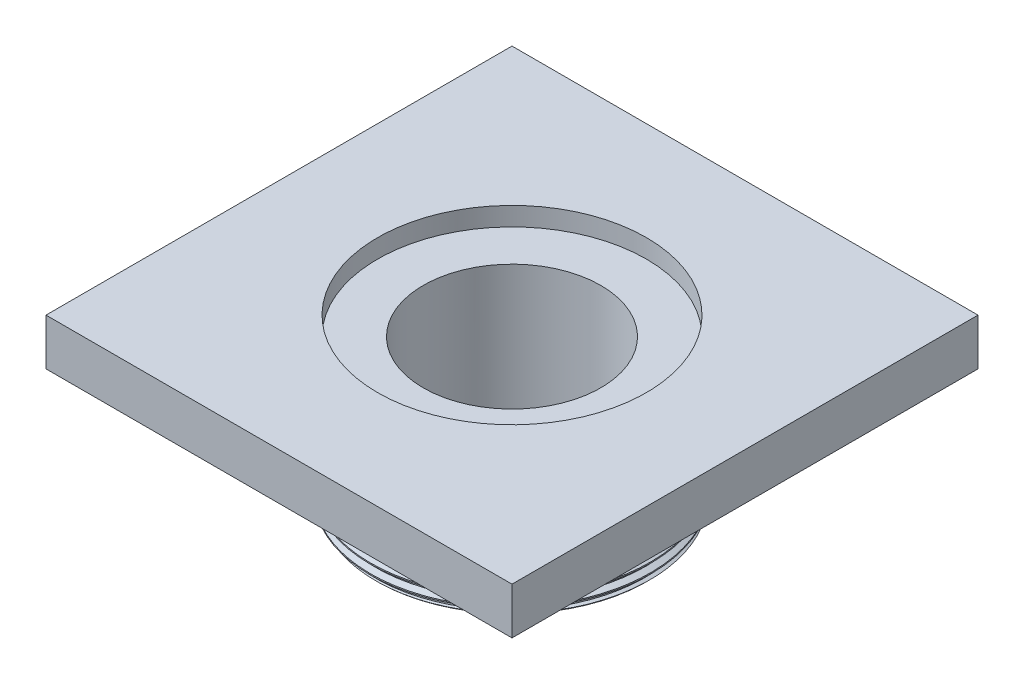
from build123d import *
from build123d.topology import SkipClean

# Parameters (mm, degrees)
SKETCH1_W           = 50
SKETCH1_H           = 50
BOSS_EXTRUDE1_DEPTH = 5
SKETCH2_R           = 15
BOSS_EXTRUDE2_DEPTH = 12.5
FILLET1_R           = 2
SKETCH3_R           = 9.525
CUT_EXTRUDE1_DEPTH  = 40.449334595
CHAMFER1_SIZE       = 0.5
THREAD1_PITCH       = 1
SKETCH6_R           = 14.415891448
CUT_EXTRUDE2_DEPTH  = 2


with BuildPart() as part:
    # Sketch1 → Boss-Extrude1 (new body)
    with BuildSketch(Plane(origin=(0, 0, 0), x_dir=(1, 0, 0), z_dir=(0, 1, 0))):
        Rectangle(SKETCH1_W, SKETCH1_H)
    extrude(amount=BOSS_EXTRUDE1_DEPTH)

    # Sketch2 → Boss-Extrude2 (add)
    with BuildSketch(Plane.XZ):
        with Locations(Location((0, 0, 0), (0, 0, 270))):
            Circle(SKETCH2_R)
    extrude(amount=BOSS_EXTRUDE2_DEPTH)

    # Fillet1
    fillet1_edges = [part.edges().sort_by_distance(p)[0] for p in [
        (0, 0, 15),
    ]]
    fillet(fillet1_edges, radius=FILLET1_R)

    # Sketch3 → Cut-Extrude1 (cut, through all)
    with BuildSketch(Plane.XZ.offset(12.5)):
        with Locations(Location((0, 0, 0), (0, 0, 270))):
            Circle(SKETCH3_R)
    extrude(amount=-CUT_EXTRUDE1_DEPTH, mode=Mode.SUBTRACT)

    # Chamfer1
    chamfer1_edges = [part.edges().sort_by_distance(p)[0] for p in [
        (0, -12.5, 15),
    ]]
    chamfer(chamfer1_edges, length=CHAMFER1_SIZE)

    # Thread1: the profile of Perfil de rosca1 profile screwed along a right-hand helix of 10.922 turns, 8 arcs to a turn; built about Z, then put on its axis
    with SkipClean():  # the faces are left unmerged after this step: merging them gives an invalid solid
        thread1_z = Axis((0, 0, 0), (0, 0, 1))
        thread1_corners = [(15.0003, 0, -0.000173205), (15.0003, 0, 0.875173202), (14.458734125, 0, 0.562499999), (14.458734125, 0, 0.312499999)]
        with BuildLine(mode=Mode.PRIVATE) as thread1_profile:
            Line(thread1_corners[0], thread1_corners[1])
            Line(thread1_corners[1], thread1_corners[2])
            Line(thread1_corners[2], thread1_corners[3])
            Line(thread1_corners[3], thread1_corners[0])
        thread1_cap = Face(thread1_profile.wire())
        thread1_turn_angles = [0, 22.5, 45, 67.5, 90, 112.5, 135, 157.5, 180, 202.5, 225, 247.5, 270, 292.5, 315, 337.5, 360]
        thread1_turn_weights = [1, 0.9238795325112867, 1, 0.9238795325112867, 1, 0.9238795325112867, 1, 0.9238795325112867, 1, 0.9238795325112867, 1, 0.9238795325112867, 1, 0.9238795325112867, 1, 0.9238795325112867, 1]
        thread1_turn_rails = [Edge.make_bspline([Vector(p[0], p[1], 0).rotate(thread1_z, thread1_turn_angles[k]) / thread1_turn_weights[k] + Vector(0, 0, p[2] + THREAD1_PITCH * thread1_turn_angles[k] / 360) for k in range(17)], [0, 0, 0, 1, 1, 2, 2, 3, 3, 4, 4, 5, 5, 6, 6, 7, 7, 8, 8, 8], 2, thread1_turn_weights) for p in thread1_corners]
        thread1_turn_sides = [Face.make_surface_from_curves(thread1_turn_rails[p[0]], thread1_turn_rails[p[1]]) for p in [(0, 1), (1, 2), (2, 3), (3, 0)]]
        thread1_last_angles = [3600, 3622.5, 3645, 3667.5, 3690, 3712.5, 3735, 3757.5, 3780, 3802.5, 3825, 3847.5, 3870, 3892.5, 3915, 3923.46, 3931.92]
        thread1_last_weights = [1, 0.9238795325112867, 1, 0.9238795325112867, 1, 0.9238795325112867, 1, 0.9238795325112867, 1, 0.9238795325112867, 1, 0.9238795325112867, 1, 0.9238795325112867, 1, 0.9891188127719617, 1]
        thread1_last_rails = [Edge.make_bspline([Vector(p[0], p[1], 0).rotate(thread1_z, thread1_last_angles[k]) / thread1_last_weights[k] + Vector(0, 0, p[2] + THREAD1_PITCH * thread1_last_angles[k] / 360) for k in range(17)], [0, 0, 0, 1, 1, 2, 2, 3, 3, 4, 4, 5, 5, 6, 6, 7, 7, 8, 8, 8], 2, thread1_last_weights) for p in thread1_corners]
        thread1_last_sides = [Face.make_surface_from_curves(thread1_last_rails[p[0]], thread1_last_rails[p[1]]) for p in [(0, 1), (1, 2), (2, 3), (3, 0)]]
        thread1 = Plane(origin=(0, -2, 0), x_dir=(-1, 0, 0), z_dir=(0, -1, 0)) * Solid(Shell([*[p.moved(Location((0, 0, THREAD1_PITCH * i))) for i in range(10) for p in thread1_turn_sides], *thread1_last_sides, thread1_cap, thread1_cap.rotate(thread1_z, 3931.92).moved(Location((0, 0, THREAD1_PITCH * 3931.92 / 360)))]))
        add(thread1, mode=Mode.SUBTRACT)

    # Sketch6 → Cut-Extrude2 (cut)
    with SkipClean():  # the faces are left unmerged after this step: merging them gives an invalid solid
        with BuildSketch(Plane(origin=(0, 5, 0), x_dir=(1, 0, 0), z_dir=(0, 1, 0))):
            with Locations(Location((0, 0, 0), (0, 0, 270))):
                Circle(SKETCH6_R)
        extrude(amount=-CUT_EXTRUDE2_DEPTH, mode=Mode.SUBTRACT)


solid = part.part
